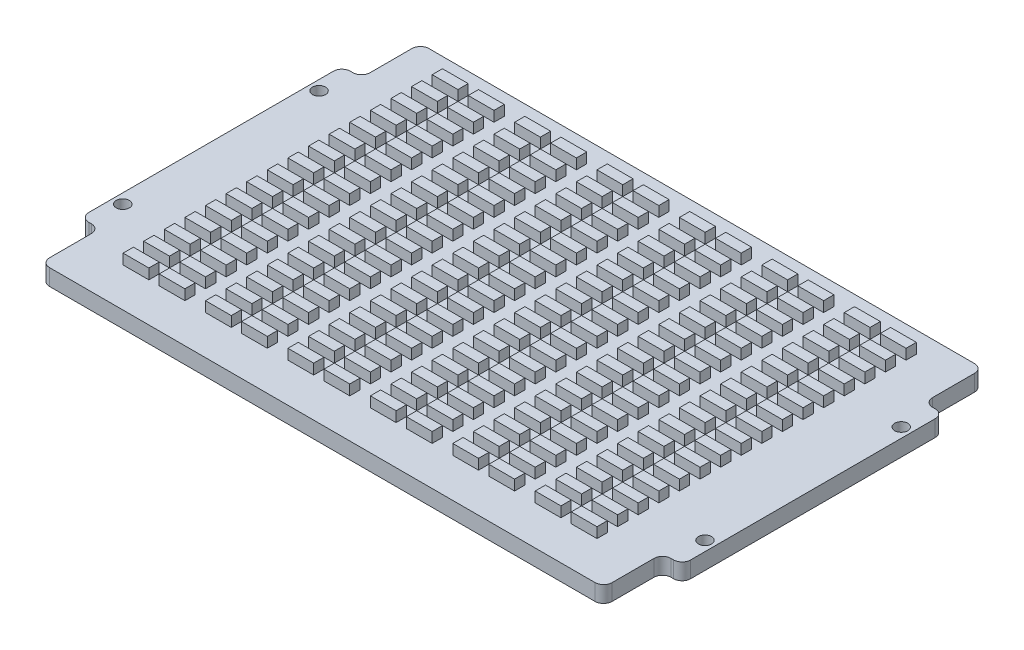
from build123d import *

# Parameters (mm, degrees)
SKETCH1_W            = 109.22
SKETCH1_H            = 73.66
BOSS_EXTRUDE1_DEPTH  = 3.175
BOSS_EXTRUDE3_DEPTH  = 1
LPATTERN1_COUNT      = 6
LPATTERN1_PITCH      = 16
LPATTERN1_COUNT_DIR2 = 16
LPATTERN1_PITCH_DIR2 = 4
SKETCH3_W            = 3.81
SKETCH3_H            = 50.8
SKETCH3_R            = 1.27
BOSS_EXTRUDE2_DEPTH  = 3.175
FILLET1_R            = 1.651


with BuildPart() as part:
    # Sketch1 → Boss-Extrude1 (new body)
    with BuildSketch(Plane(origin=(0, 0, 0), x_dir=(1, 0, 0), z_dir=(0, 1, 0))):
        Rectangle(SKETCH1_W, SKETCH1_H)
    extrude(amount=-BOSS_EXTRUDE1_DEPTH)

    # Sketch2 → Boss-Extrude3 (add, symmetric)
    with BuildSketch(Plane.XY.offset(-31.75)):
        Polygon((-43.75, 0), (-46.25, 0), (-46.25, 2), (-41.25, 2), (-41.25, 0), align=None)
        Polygon((-39.25, 2), (-34.25, 2), (-34.25, 0), (-36.75, 0), (-39.25, 0), align=None)
    boss_extrude3 = extrude(amount=BOSS_EXTRUDE3_DEPTH, both=True)

    # LPattern1: Boss-Extrude3 6 × 16
    with Locations(*[(i * LPATTERN1_PITCH, 0, j * LPATTERN1_PITCH_DIR2) for i in range(LPATTERN1_COUNT) for j in range(LPATTERN1_COUNT_DIR2) if (i, j) != (0, 0)]):
        add(boss_extrude3)

    # Sketch3 → Boss-Extrude2 (add)
    # profile 1 of 2: a face of its own
    with BuildSketch(Plane(origin=(0, 0, 0), x_dir=(1, 0, 0), z_dir=(0, 1, 0))):
        with Locations((-56.515, 0)):
            Rectangle(SKETCH3_W, SKETCH3_H)
        with Locations((-56.515, 19.05)):
            Circle(SKETCH3_R, mode=Mode.SUBTRACT)
        with Locations((-56.515, -19.05)):
            Circle(SKETCH3_R, mode=Mode.SUBTRACT)
    # profile 2 of 2: a face of its own
    with BuildSketch(Plane(origin=(0, 0, 0), x_dir=(1, 0, 0), z_dir=(0, 1, 0))):
        with Locations((56.515, 0)):
            Rectangle(SKETCH3_W, SKETCH3_H)
        with Locations((56.515, -19.05)):
            Circle(SKETCH3_R, mode=Mode.SUBTRACT)
        with Locations((56.515, 19.05)):
            Circle(SKETCH3_R, mode=Mode.SUBTRACT)
    extrude(amount=-BOSS_EXTRUDE2_DEPTH)

    # Fillet1
    fillet1_edges = [part.edges().sort_by_distance(p)[0] for p in [
        (54.61, -1.5875, -36.83),
        (54.61, -1.5875, -25.4),
        (58.42, -1.5875, -25.4),
        (58.42, -1.5875, 25.4),
        (54.61, -1.5875, 25.4),
        (54.61, -1.5875, 36.83),
        (-54.61, -1.5875, 36.83),
        (-54.61, -1.5875, 25.4),
        (-58.42, -1.5875, 25.4),
        (-58.42, -1.5875, -25.4),
        (-54.61, -1.5875, -25.4),
        (-54.61, -1.5875, -36.83),
    ]]
    fillet(fillet1_edges, radius=FILLET1_R)


solid = part.part
